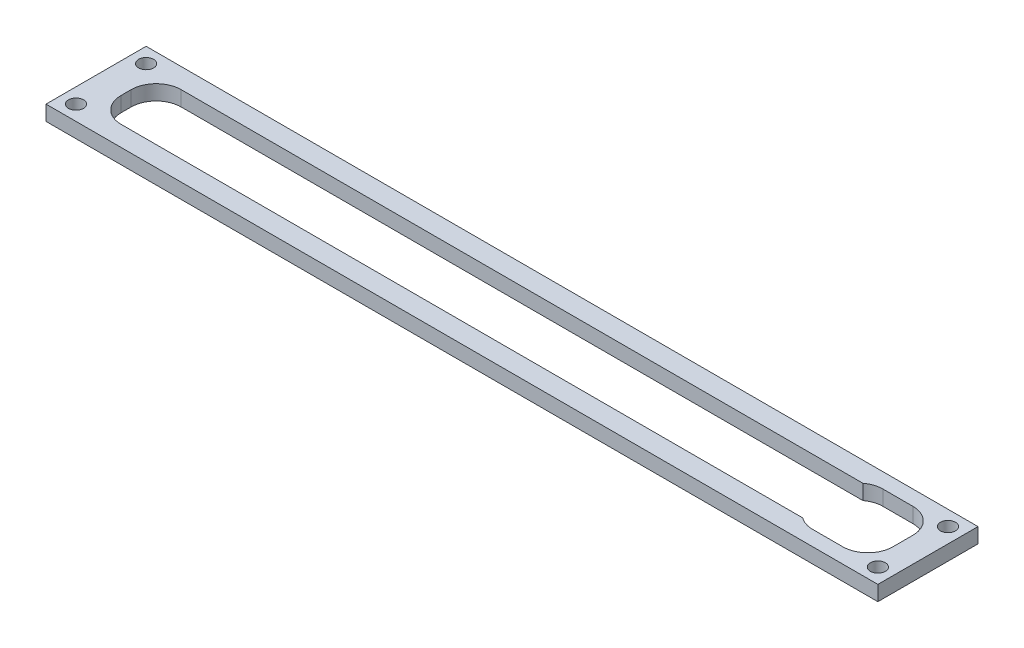
from build123d import *

# Parameters (mm, degrees)
SKETCH1_W           = 166.159725664
SKETCH1_H           = 20
SKETCH1_R           = 1.5
SKETCH1_W_2         = 154.159725664
SKETCH1_H_2         = 12
BOSS_EXTRUDE1_DEPTH = 3
CUT_EXTRUDE1_DEPTH  = 168.38594455
FILLET1_R           = 5


with BuildPart() as part:
    # Sketch1 → Boss-Extrude1 (new body)
    with BuildSketch(Plane(origin=(0, 0, 0), x_dir=(1, 0, 0), z_dir=(0, 1, 0))):
        with Locations((83.079862832, 10)):
            Rectangle(SKETCH1_W, SKETCH1_H)
        with Locations(Location((3, 17, 0), (0, 0, 270))):
            Circle(SKETCH1_R, mode=Mode.SUBTRACT)
        with Locations(Location((3, 3, 0), (0, 0, 90))):
            Circle(SKETCH1_R, mode=Mode.SUBTRACT)
        with Locations(Location((163.159725664, 3, 0), (0, 0, 270))):
            Circle(SKETCH1_R, mode=Mode.SUBTRACT)
        with Locations(Location((163.159725664, 17, 0), (0, 0, 90))):
            Circle(SKETCH1_R, mode=Mode.SUBTRACT)
        with Locations((83.079862832, 10)):
            Rectangle(SKETCH1_W_2, SKETCH1_H_2, mode=Mode.SUBTRACT)
    extrude(amount=BOSS_EXTRUDE1_DEPTH)

    # Sketch2 → Cut-Extrude1 (cut, through all)
    with BuildSketch(Plane(origin=(0, 3, 0), x_dir=(1, 0, 0), z_dir=(0, 1, 0))):
        Polygon((147.159725664, 17), (147.159725664, 16), (160.159725664, 16), (160.159725664, 4), (147.159725664, 4), (147.159725664, 3), (161.159725664, 3), (161.159725664, 17), align=None)
    extrude(amount=-CUT_EXTRUDE1_DEPTH, mode=Mode.SUBTRACT)

    # Fillet1
    # the kernel refuses this fillet: 5 mm, written as the material it adds along each edge
    with BuildSketch(Plane(origin=(161.159725664, 3, -17), x_dir=(0, 0, 1), z_dir=(0, -1, 0)), Plane(origin=(161.159725664, 3, -3), x_dir=(-1, 0, 0), z_dir=(0, -1, 0)), Plane(origin=(6, 0, -16), x_dir=(0, 0, 1), z_dir=(0, 1, 0))) as fillet1_piece_1:
        with BuildLine():
            CenterArc((FILLET1_R, FILLET1_R), FILLET1_R, 180, 90)
            Line((0, FILLET1_R), (-FILLET1_R * 0.02, FILLET1_R))
            Line((-FILLET1_R * 0.02, FILLET1_R), (-FILLET1_R * 0.02, -FILLET1_R * 0.02))
            Line((-FILLET1_R * 0.02, -FILLET1_R * 0.02), (FILLET1_R, -FILLET1_R * 0.02))
            Line((FILLET1_R, -FILLET1_R * 0.02), (FILLET1_R, 0))
        make_face()
    extrude(amount=3)
    with BuildSketch(Plane(origin=(147.159725664, 3, -17), x_dir=(1, 0, 0), z_dir=(0, -1, 0))) as fillet1_piece_2:
        with BuildLine():
            CenterArc((3, 5), FILLET1_R, 233.130102354, 36.869897646)
            Line((0, 1), (-0.06, 0.92))
            ThreePointArc((-0.06, 0.92), (-0.1, 0.5), (-0.1, 0))
            Line((-0.1, 0), (0, -0.1))
            Line((0, -0.1), (3, -0.1))
            Line((3, -0.1), (3, 0))
        make_face()
    extrude(amount=3)
    with BuildSketch(Plane(origin=(147.159725664, 3, -3), x_dir=(0, 0, -1), z_dir=(0, -1, 0))) as fillet1_piece_3:
        with BuildLine():
            CenterArc((5, 3), FILLET1_R, 180, 36.869897646)
            Line((0, 3), (-0.1, 3))
            Line((-0.1, 3), (-0.1, 0))
            Line((-0.1, 0), (0, -0.1))
            ThreePointArc((0, -0.1), (0.5, -0.1), (0.92, -0.06))
            Line((0.92, -0.06), (1, 0))
        make_face()
    extrude(amount=3)
    with BuildSketch(Plane(origin=(6, 0, -4), x_dir=(0, 0, -1), z_dir=(0, 1, 0))) as fillet1_piece_4:
        with BuildLine():
            CenterArc((FILLET1_R, -FILLET1_R), FILLET1_R, 90, 90)
            Line((0, -FILLET1_R), (-FILLET1_R * 0.02, -FILLET1_R))
            Line((-FILLET1_R * 0.02, -FILLET1_R), (-FILLET1_R * 0.02, FILLET1_R * 0.02))
            Line((-FILLET1_R * 0.02, FILLET1_R * 0.02), (FILLET1_R, FILLET1_R * 0.02))
            Line((FILLET1_R, FILLET1_R * 0.02), (FILLET1_R, 0))
        make_face()
    extrude(amount=3)


solid = part.part
